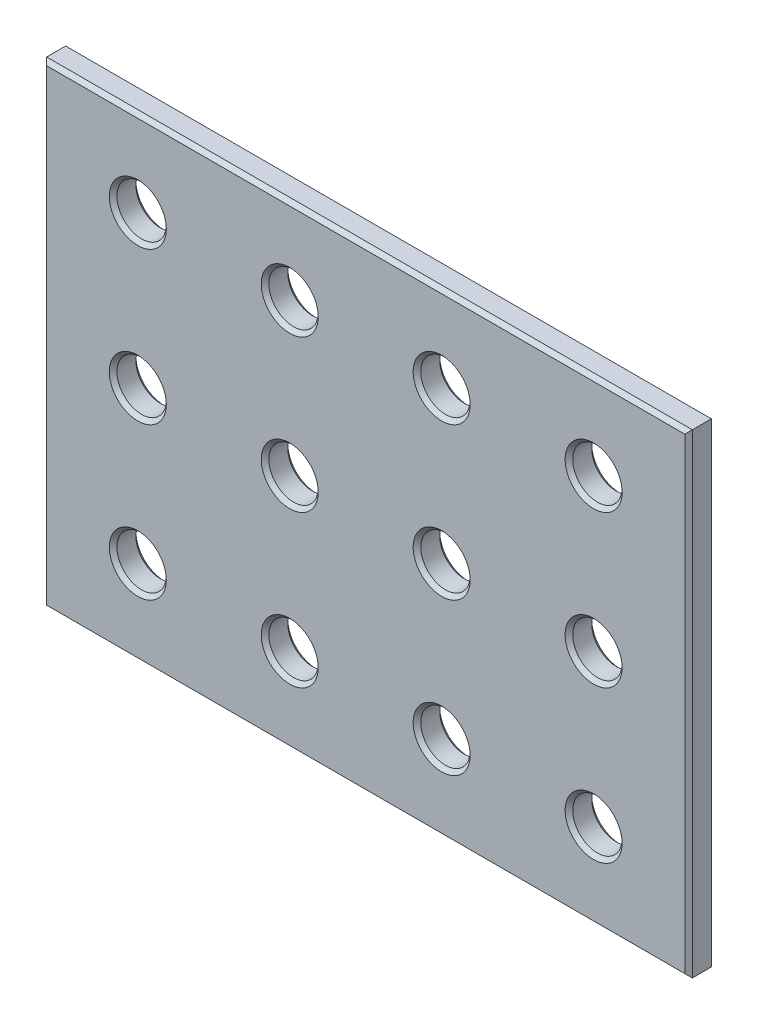
from build123d import *

# Parameters (mm, degrees)
SKETCH_1_W        = 340
SKETCH_1_H        = 250
SKETCH_1_R        = 13
EXTRUDE_409_DEPTH = 14
CHAMFER_1_SIZE    = 2


with BuildPart() as part:
    # 草图1 → Extrude 409 (new body)
    with BuildSketch(Plane.XY):
        Rectangle(SKETCH_1_W, SKETCH_1_H)
        with Locations((-120, 80)):
            Circle(SKETCH_1_R, mode=Mode.SUBTRACT)
        with Locations((-40, 80)):
            Circle(SKETCH_1_R, mode=Mode.SUBTRACT)
        with Locations((-40, 0)):
            Circle(SKETCH_1_R, mode=Mode.SUBTRACT)
        with Locations((-120, 0)):
            Circle(SKETCH_1_R, mode=Mode.SUBTRACT)
        with Locations((-40, -80)):
            Circle(SKETCH_1_R, mode=Mode.SUBTRACT)
        with Locations((-120, -80)):
            Circle(SKETCH_1_R, mode=Mode.SUBTRACT)
        with Locations((120, -80)):
            Circle(SKETCH_1_R, mode=Mode.SUBTRACT)
        with Locations((40, -80)):
            Circle(SKETCH_1_R, mode=Mode.SUBTRACT)
        with Locations((120, 0)):
            Circle(SKETCH_1_R, mode=Mode.SUBTRACT)
        with Locations((40, 0)):
            Circle(SKETCH_1_R, mode=Mode.SUBTRACT)
        with Locations((40, 80)):
            Circle(SKETCH_1_R, mode=Mode.SUBTRACT)
        with Locations((120, 80)):
            Circle(SKETCH_1_R, mode=Mode.SUBTRACT)
    extrude(amount=EXTRUDE_409_DEPTH)

    # 倒角1
    chamfer_1_edges = [part.edges().sort_by_distance(p)[0] for p in [
        (107, 80, 0),
        (27, 0, 0),
        (27, -80, 0),
        (-133, -80, 0),
        (-133, 0, 0),
        (-53, 80, 0),
        (0, -125, 0),
        (170, 0, 0),
        (0, 125, 0),
        (-170, 0, 0),
        (-133, 80, 0),
        (-53, 0, 0),
        (-53, -80, 0),
        (107, -80, 0),
        (107, 0, 0),
        (27, 80, 0),
        (107, 80, 14),
        (27, 0, 14),
        (27, -80, 14),
        (-133, -80, 14),
        (-133, 0, 14),
        (-53, 80, 14),
        (0, 125, 14),
        (170, 0, 14),
        (0, -125, 14),
        (-170, 0, 14),
        (-133, 80, 14),
        (-53, 0, 14),
        (-53, -80, 14),
        (107, -80, 14),
        (107, 0, 14),
        (27, 80, 14),
    ]]
    chamfer(chamfer_1_edges, length=CHAMFER_1_SIZE)


solid = part.part
